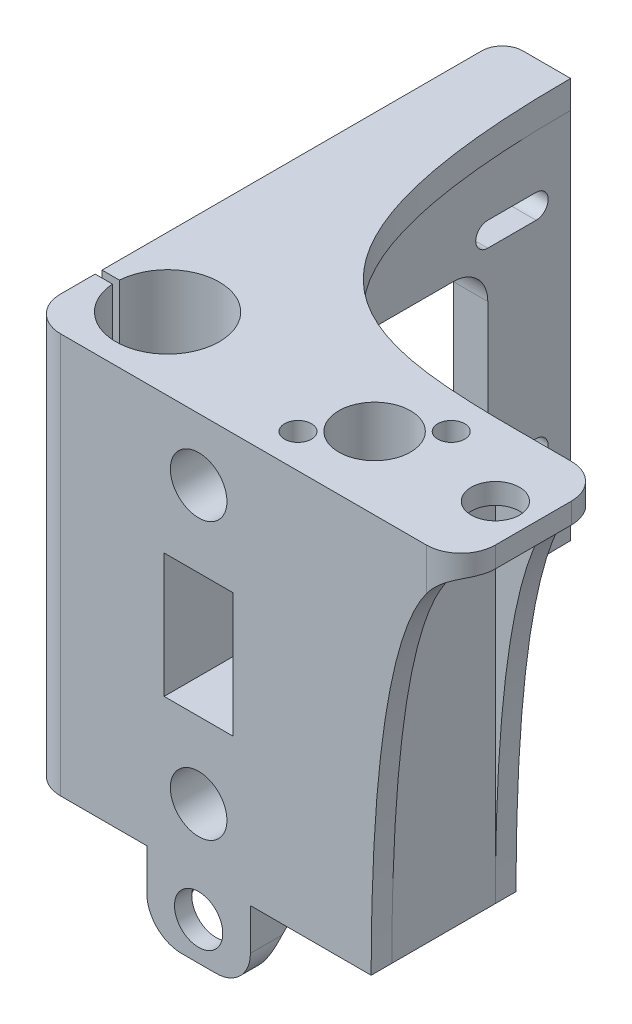
from build123d import *

# Parameters (mm, degrees)
SKETCH1_W                = 50
SKETCH1_H                = 21
BOSS_EXTRUDE1_DEPTH      = 58
SKETCH3_R                = 7.5
CUT_EXTRUDE1_DEPTH       = 24
CUT_EXTRUDE2_REACH       = 66.025
SKETCH4_R                = 5.2
CUT_EXTRUDE3_START       = -24
SKETCH5_R                = 7.5
CUT_EXTRUDE3_DEPTH       = 24
CUT_EXTRUDE4_REACH       = 66.025
SKETCH6_R                = 4.5
CUT_EXTRUDE5_REACH       = 68.558
SKETCH8_W                = 10
SKETCH8_H                = 18
SKETCH9_W                = 5
SKETCH9_H                = 58
BOSS_EXTRUDE3_DEPTH      = 48
CUT_EXTRUDE7_REACH       = 95.916
BOSS_EXTRUDE4_START      = -25
BOSS_EXTRUDE4_OUTLINE_W  = 4
BOSS_EXTRUDE4_OUTLINE_H  = 48
BOSS_EXTRUDE4_DEPTH      = 50.0000001
BOSS_EXTRUDE4_2_DEPTH    = 4
SKETCH7_R                = 4.1
CUT_EXTRUDE8_DEPTH       = 15
SKETCH19_R               = 1.95
CUT_EXTRUDE11_DEPTH      = 10
CUT_EXTRUDE12_DEPTH      = 87.088617327
CUT_EXTRUDE12_DEPTH_BACK = 87.088617327
SKETCH20_W               = 5.527864045
SKETCH20_H               = 1
BOSS_EXTRUDE5_DEPTH      = 13
CUT_EXTRUDE13_START      = -69
CUT_EXTRUDE13_DEPTH      = 69
CUT_EXTRUDE14_REACH      = 90.833
SKETCH23_R               = 3.5
BOSS_EXTRUDE7_DEPTH      = 11
CUT_EXTRUDE15_REACH      = 98.074
SKETCH26_R               = 3.5
CUT_EXTRUDE16_DEPTH      = 15
FILLET1_R                = 5


with BuildPart() as part:
    # Sketch1 → Boss-Extrude1 (new body)
    with BuildSketch(Plane(origin=(0, 0, 0), x_dir=(1, 0, 0), z_dir=(0, 1, 0))):
        Rectangle(SKETCH1_W, SKETCH1_H)
    extrude(amount=BOSS_EXTRUDE1_DEPTH)

    # Sketch3 → Cut-Extrude1 (cut)
    with BuildSketch(Plane(origin=(0, 58, 0), x_dir=(1, 0, 0), z_dir=(0, 1, 0))):
        with Locations(Location((-15, 0, 0), (0, 0, 270))):
            Circle(SKETCH3_R)
    extrude(amount=-CUT_EXTRUDE1_DEPTH, mode=Mode.SUBTRACT)

    # Sketch4 → Cut-Extrude2 (cut, up to next)
    with BuildSketch(Plane(origin=(0, 58, 0), x_dir=(1, 0, 0), z_dir=(0, 1, 0)), mode=Mode.PRIVATE) as cut_extrude2_sk1:
        with Locations(Location((15, 0, 0), (0, 0, 270))):
            Circle(SKETCH4_R)
    cut_extrude2_tool1 = extrude(cut_extrude2_sk1.sketch, amount=-CUT_EXTRUDE2_REACH, mode=Mode.PRIVATE) & part.part
    add(cut_extrude2_tool1.solids().sort_by_distance((15, 58, 0))[0], mode=Mode.SUBTRACT)

    # Sketch5 → Cut-Extrude3 (cut)
    with BuildSketch(Plane.XZ.offset(CUT_EXTRUDE3_START)):
        with Locations(Location((-15, 0, 0), (0, 0, 90))):
            Circle(SKETCH5_R)
    extrude(amount=CUT_EXTRUDE3_DEPTH, mode=Mode.SUBTRACT)

    # Sketch6 → Cut-Extrude4 (cut, up to next)
    with BuildSketch(Plane.XZ, mode=Mode.PRIVATE) as cut_extrude4_sk1:
        with Locations(Location((-15, 0, 0), (0, 0, 270))):
            Circle(SKETCH6_R)
    cut_extrude4_tool1 = extrude(cut_extrude4_sk1.sketch, amount=-CUT_EXTRUDE4_REACH, mode=Mode.PRIVATE) & part.part
    add(cut_extrude4_tool1.solids().sort_by_distance((-15, 0, 0))[0], mode=Mode.SUBTRACT)

    # Sketch8 → Cut-Extrude5 (cut, up to next)
    with BuildSketch(Plane.XY.offset(10.5), mode=Mode.PRIVATE) as cut_extrude5_sk1:
        with Locations((0, 29)):
            Rectangle(SKETCH8_W, SKETCH8_H)
    cut_extrude5_tool1 = extrude(cut_extrude5_sk1.sketch, amount=-CUT_EXTRUDE5_REACH, mode=Mode.PRIVATE) & part.part
    add(cut_extrude5_tool1.solids().sort_by_distance((0, 29, 10.5))[0], mode=Mode.SUBTRACT)

    # Sketch9 → Boss-Extrude3 (add)
    with BuildSketch(Plane(origin=(0, 0, -10.5), x_dir=(-1, 0, 0), z_dir=(0, 0, -1))):
        with Locations((17.6, 29)):
            Rectangle(SKETCH9_W, SKETCH9_H)
    extrude(amount=BOSS_EXTRUDE3_DEPTH)

    # Sketch10 → Cut-Extrude7 (cut, up to next)
    with BuildSketch(Plane.ZY.offset(20.1), mode=Mode.PRIVATE) as cut_extrude7_sk1:
        with BuildLine():
            Line((-46.5, 46.2), (-53.5, 46.2))
            ThreePointArc((-53.5, 46.2), (-55.25, 44.45), (-53.5, 42.7))
            Line((-53.5, 42.7), (-46.5, 42.7))
            ThreePointArc((-46.5, 42.7), (-44.75, 44.45), (-46.5, 46.2))
        make_face()
    cut_extrude7_tool1 = extrude(cut_extrude7_sk1.sketch, amount=-CUT_EXTRUDE7_REACH, mode=Mode.PRIVATE) & part.part
    # Sketch10 → Cut-Extrude7 (cut, up to next)
    with BuildSketch(Plane.ZY.offset(20.1), mode=Mode.PRIVATE) as cut_extrude7_sk2:
        with BuildLine():
            Line((-41.5, 17), (-27.5, 17))
            ThreePointArc((-27.5, 17), (-23.964466094, 18.464466094), (-22.5, 22))
            Line((-22.5, 22), (-22.5, 36))
            ThreePointArc((-22.5, 36), (-23.964466094, 39.535533906), (-27.5, 41))
            Line((-27.5, 41), (-41.5, 41))
            ThreePointArc((-41.5, 41), (-45.035533906, 39.535533906), (-46.5, 36))
            Line((-46.5, 36), (-46.5, 22))
            ThreePointArc((-46.5, 22), (-45.035533906, 18.464466094), (-41.5, 17))
        make_face()
    cut_extrude7_tool2 = extrude(cut_extrude7_sk2.sketch, amount=-CUT_EXTRUDE7_REACH, mode=Mode.PRIVATE) & part.part
    # Sketch10 → Cut-Extrude7 (cut, up to next)
    with BuildSketch(Plane.ZY.offset(20.1), mode=Mode.PRIVATE) as cut_extrude7_sk3:
        with BuildLine():
            Line((-15.5, 15.3), (-22.5, 15.3))
            ThreePointArc((-22.5, 15.3), (-24.25, 13.55), (-22.5, 11.8))
            Line((-22.5, 11.8), (-15.5, 11.8))
            ThreePointArc((-15.5, 11.8), (-13.75, 13.55), (-15.5, 15.3))
        make_face()
    cut_extrude7_tool3 = extrude(cut_extrude7_sk3.sketch, amount=-CUT_EXTRUDE7_REACH, mode=Mode.PRIVATE) & part.part
    # Sketch10 → Cut-Extrude7 (cut, up to next)
    with BuildSketch(Plane.ZY.offset(20.1), mode=Mode.PRIVATE) as cut_extrude7_sk4:
        with BuildLine():
            Line((-46.5, 11.8), (-53.5, 11.8))
            ThreePointArc((-53.5, 11.8), (-55.25, 13.55), (-53.5, 15.3))
            Line((-53.5, 15.3), (-46.5, 15.3))
            ThreePointArc((-46.5, 15.3), (-44.75, 13.55), (-46.5, 11.8))
        make_face()
    cut_extrude7_tool4 = extrude(cut_extrude7_sk4.sketch, amount=-CUT_EXTRUDE7_REACH, mode=Mode.PRIVATE) & part.part
    # Sketch10 → Cut-Extrude7 (cut, up to next)
    with BuildSketch(Plane.ZY.offset(20.1), mode=Mode.PRIVATE) as cut_extrude7_sk5:
        with BuildLine():
            Line((-15.5, 46.2), (-22.5, 46.2))
            ThreePointArc((-22.5, 46.2), (-24.25, 44.45), (-22.5, 42.7))
            Line((-22.5, 42.7), (-15.5, 42.7))
            ThreePointArc((-15.5, 42.7), (-13.75, 44.45), (-15.5, 46.2))
        make_face()
    cut_extrude7_tool5 = extrude(cut_extrude7_sk5.sketch, amount=-CUT_EXTRUDE7_REACH, mode=Mode.PRIVATE) & part.part
    add(cut_extrude7_tool1.solids().sort_by_distance((-20.1, 44.45, -50))[0], mode=Mode.SUBTRACT)
    add(cut_extrude7_tool2.solids().sort_by_distance((-20.1, 29, -34.5))[0], mode=Mode.SUBTRACT)
    add(cut_extrude7_tool3.solids().sort_by_distance((-20.1, 13.55, -19))[0], mode=Mode.SUBTRACT)
    add(cut_extrude7_tool4.solids().sort_by_distance((-20.1, 13.55, -50))[0], mode=Mode.SUBTRACT)
    add(cut_extrude7_tool5.solids().sort_by_distance((-20.1, 44.45, -19))[0], mode=Mode.SUBTRACT)

    # Boss-Extrude4: read off the stored shape, not the designer's step
    # Boss-Extrude4 outline → Boss-Extrude4 (add)
    with BuildSketch(Plane.YZ.offset(BOSS_EXTRUDE4_START)):
        with Locations((2, -34.5)):
            Rectangle(BOSS_EXTRUDE4_OUTLINE_W, BOSS_EXTRUDE4_OUTLINE_H)
    boss_extrude4 = extrude(amount=BOSS_EXTRUDE4_DEPTH)

    # Boss-Extrude4 2 outline → Boss-Extrude4 2 (cut)
    with BuildSketch(Plane(origin=(0, 0, 0), x_dir=(1, 0, 0), z_dir=(0, 1, 0))):
        with BuildLine():
            Line((25.0000001, 58.5), (-15.1, 58.5))
            add(Edge.make_bspline(
                [(-15.1, 58.5), (-15.109460691, 13.119942058), (0.853801952, 10.552902486), (25, 10.5)],
                knots=[0, 0, 0, 0, 1, 1, 1, 1], degree=3))
            Line((25, 10.5), (25.0000001, 58.5))
        make_face()
        with BuildLine():
            ThreePointArc((-25, 55.5), (-24.121320344, 57.621320344), (-22, 58.5))
            Line((-22, 58.5), (-25, 58.5))
            Line((-25, 58.5), (-25, 55.5))
        make_face()
    boss_extrude4_2 = extrude(amount=BOSS_EXTRUDE4_2_DEPTH, mode=Mode.SUBTRACT)

    # Mirror1: Boss-Extrude4, Boss-Extrude4 2 across plane
    add(boss_extrude4.mirror(Plane(origin=(0, 29, 0), x_dir=(0, 0, 1), z_dir=(0, -1, 0))))
    add(boss_extrude4_2.mirror(Plane(origin=(0, 29, 0), x_dir=(0, 0, 1), z_dir=(0, -1, 0))), mode=Mode.SUBTRACT)

    # Sketch7 → Cut-Extrude8 (cut)
    with BuildSketch(Plane.XY.offset(10.5)):
        with Locations((0, 49)):
            Circle(SKETCH7_R)
        with Locations(Location((0, 9, 0), (0, 0, 180))):
            Circle(SKETCH7_R)
    extrude(amount=-CUT_EXTRUDE8_DEPTH, mode=Mode.SUBTRACT)

    # Sketch19 → Cut-Extrude11 (cut)
    with BuildSketch(Plane(origin=(0, 58, 0), x_dir=(1, 0, 0), z_dir=(0, 1, 0))):
        with Locations(Location((20.550788232, 5.550788232, 0), (0, 0, 270))):
            Circle(SKETCH19_R)
        with Locations(Location((9.449211768, -5.550788232, 0), (0, 0, 270))):
            Circle(SKETCH19_R)
    extrude(amount=-CUT_EXTRUDE11_DEPTH, mode=Mode.SUBTRACT)

    # Sketch20 → Cut-Extrude12 (cut, two sides: drawn at the far end of the back side and taken through both)
    with BuildSketch(Plane.XZ.offset(-CUT_EXTRUDE12_DEPTH_BACK)):
        with Locations((-22.236067977, 0)):
            Rectangle(SKETCH20_W, SKETCH20_H)
    extrude(amount=CUT_EXTRUDE12_DEPTH + CUT_EXTRUDE12_DEPTH_BACK, mode=Mode.SUBTRACT)

    # Sketch21 → Boss-Extrude5 (add)
    with BuildSketch(Plane(origin=(25, 0, 0), x_dir=(0, 0, -1), z_dir=(1, 0, 0))):
        Polygon((10.5, 0), (10.5, 58), (-10.5, 58), (-10.5, 0), (-7.5, 0), (-7.5, 55), (7.5, 55), (7.5, 0), align=None)
    extrude(amount=BOSS_EXTRUDE5_DEPTH)

    # Sketch22 → Cut-Extrude13 (cut)
    with BuildSketch(Plane.XY.offset(10.5).offset(CUT_EXTRUDE13_START)):
        with BuildLine():
            Line((25, 0), (38, 0))
            Line((38, 0), (38, 55))
            add(Edge.make_bspline(
                [(38, 55), (31.45567161, 55), (25, 40.968536323), (25, 0)],
                knots=[0, 0, 0, 0, 1, 1, 1, 1], degree=3))
        make_face()
    extrude(amount=CUT_EXTRUDE13_DEPTH, mode=Mode.SUBTRACT)

    # Sketch23 → Cut-Extrude14 (cut, up to next)
    with BuildSketch(Plane.XZ.offset(-55), mode=Mode.PRIVATE) as cut_extrude14_sk1:
        with Locations(Location((32.5, 0, 0), (0, 0, 270))):
            Circle(SKETCH23_R)
    cut_extrude14_tool1 = extrude(cut_extrude14_sk1.sketch, amount=-CUT_EXTRUDE14_REACH, mode=Mode.PRIVATE) & part.part
    add(cut_extrude14_tool1.solids().sort_by_distance((32.5, 55, 0))[0], mode=Mode.SUBTRACT)

    # Sketch24 → Boss-Extrude7 (add)
    with BuildSketch(Plane.XZ):
        Polygon((7.5, 10.5), (7.5, -11.859875449), (5, -11.859875449), (5, 8), (-5, 8), (-5, -11.859875449), (-7.5, -11.859875449), (-7.5, 10.5), align=None)
    extrude(amount=BOSS_EXTRUDE7_DEPTH)

    # Sketch26 → Cut-Extrude15 (cut, up to next)
    with BuildSketch(Plane(origin=(0, 0, 8), x_dir=(-1, 0, 0), z_dir=(0, 0, -1)), mode=Mode.PRIVATE) as cut_extrude15_sk1:
        with Locations((0, -5.5)):
            Circle(SKETCH26_R)
    cut_extrude15_tool1 = extrude(cut_extrude15_sk1.sketch, amount=-CUT_EXTRUDE15_REACH, mode=Mode.PRIVATE) & part.part
    add(cut_extrude15_tool1.solids().sort_by_distance((0, -5.5, 8))[0], mode=Mode.SUBTRACT)

    # Sketch27 → Cut-Extrude16 (cut)
    with BuildSketch(Plane.ZY.offset(7.5)):
        with BuildLine():
            Line((8, -11), (-11.859875449, -11))
            Line((-11.859875449, -11), (-11.859875449, 0))
            add(Edge.make_bspline(
                [(8, -11), (8, -5.603660731), (0.903317246, 0), (-11.859875449, 0)],
                knots=[0, 0, 0, 0, 1, 1, 1, 1], degree=3))
        make_face()
    extrude(amount=-CUT_EXTRUDE16_DEPTH, mode=Mode.SUBTRACT)

    # Fillet1
    # the kernel refuses this fillet: 5 mm, written as the material it takes off along each edge
    with BuildSketch(Plane(origin=(-25, -12.5, 10.5), x_dir=(1, 0, 0), z_dir=(0, 1, 0))) as fillet1_piece_1:
        with BuildLine():
            CenterArc((FILLET1_R, FILLET1_R), FILLET1_R, 180, 90)
            Line((0, FILLET1_R), (0, 0))
            Line((0, 0), (FILLET1_R, 0))
        make_face()
    extrude(amount=83, mode=Mode.SUBTRACT)
    with BuildSketch(Plane(origin=(38, 70.5, 10.5), x_dir=(-1, 0, 0), z_dir=(0, -1, 0)), Plane(origin=(38, 42.5, -10.5), x_dir=(-1, 0, 0), z_dir=(0, 1, 0))) as fillet1_piece_2:
        with BuildLine():
            CenterArc((FILLET1_R, FILLET1_R), FILLET1_R, 180, 90)
            Line((0, FILLET1_R), (0, 0))
            Line((0, 0), (FILLET1_R, 0))
        make_face()
    extrude(amount=28, mode=Mode.SUBTRACT)
    with BuildSketch(Plane(origin=(-7.5, -11, -4.5), x_dir=(1, 0, 0), z_dir=(0, 0, 1))) as fillet1_piece_3:
        with BuildLine():
            CenterArc((FILLET1_R, FILLET1_R), FILLET1_R, 180, 90)
            Line((0, FILLET1_R), (0, 0))
            Line((0, 0), (FILLET1_R, 0))
        make_face()
    extrude(amount=27.5, mode=Mode.SUBTRACT)
    with BuildSketch(Plane(origin=(7.5, -11, 23), x_dir=(0, 1, 0), z_dir=(0, 0, -1))) as fillet1_piece_4:
        with BuildLine():
            CenterArc((FILLET1_R, -FILLET1_R), FILLET1_R, 90, 90)
            Line((0, -FILLET1_R), (0, 0))
            Line((0, 0), (FILLET1_R, 0))
        make_face()
    extrude(amount=27.5, mode=Mode.SUBTRACT)


solid = part.part
